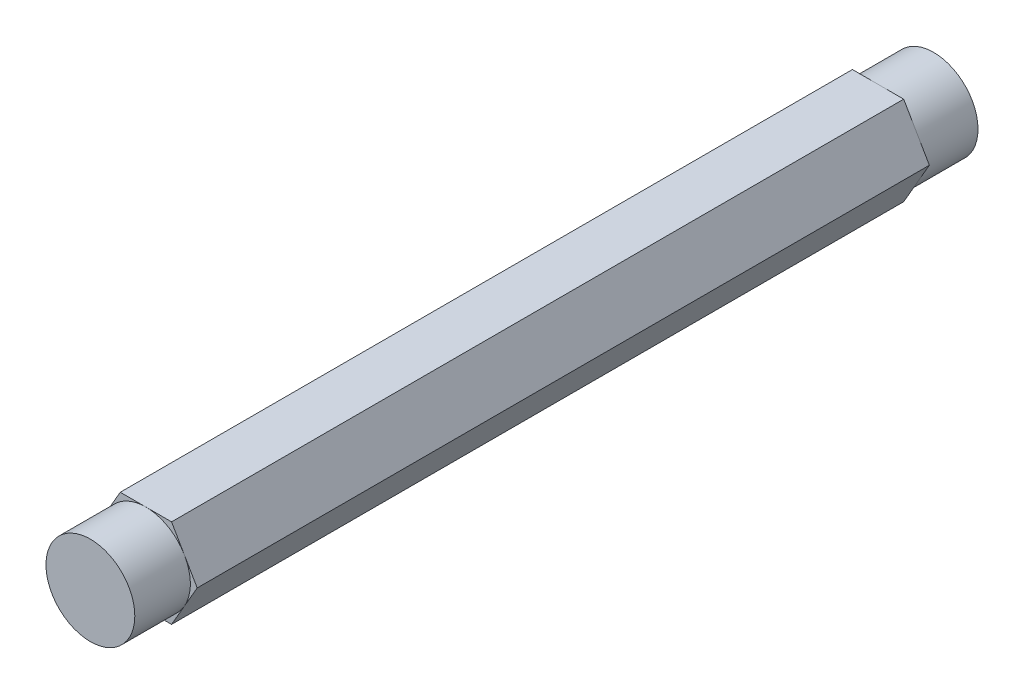
from build123d import *

# Parameters (mm, degrees)
SKETCH1_R           = 6.35
BOSS_EXTRUDE1_DEPTH = 7.9375
BOSS_EXTRUDE2_DEPTH = 104.6734
SKETCH3_R           = 6.35
BOSS_EXTRUDE3_DEPTH = 7.9375


with BuildPart() as part:
    # Sketch1 → Boss-Extrude1 (new body)
    with BuildSketch(Plane.XY):
        Circle(SKETCH1_R)
    extrude(amount=BOSS_EXTRUDE1_DEPTH)

    # Sketch2 → Boss-Extrude2 (add)
    with BuildSketch(Plane.XY.offset(7.9375)):
        Polygon((7.332348419, 0), (3.666174209, 6.35), (-3.666174209, 6.35), (-7.332348419, 0), (-3.666174209, -6.35), (3.666174209, -6.35), align=None)
    extrude(amount=BOSS_EXTRUDE2_DEPTH)

    # Sketch3 → Boss-Extrude3 (add)
    with BuildSketch(Plane.XY.offset(112.6109)):
        Circle(SKETCH3_R)
    extrude(amount=BOSS_EXTRUDE3_DEPTH)


solid = part.part
